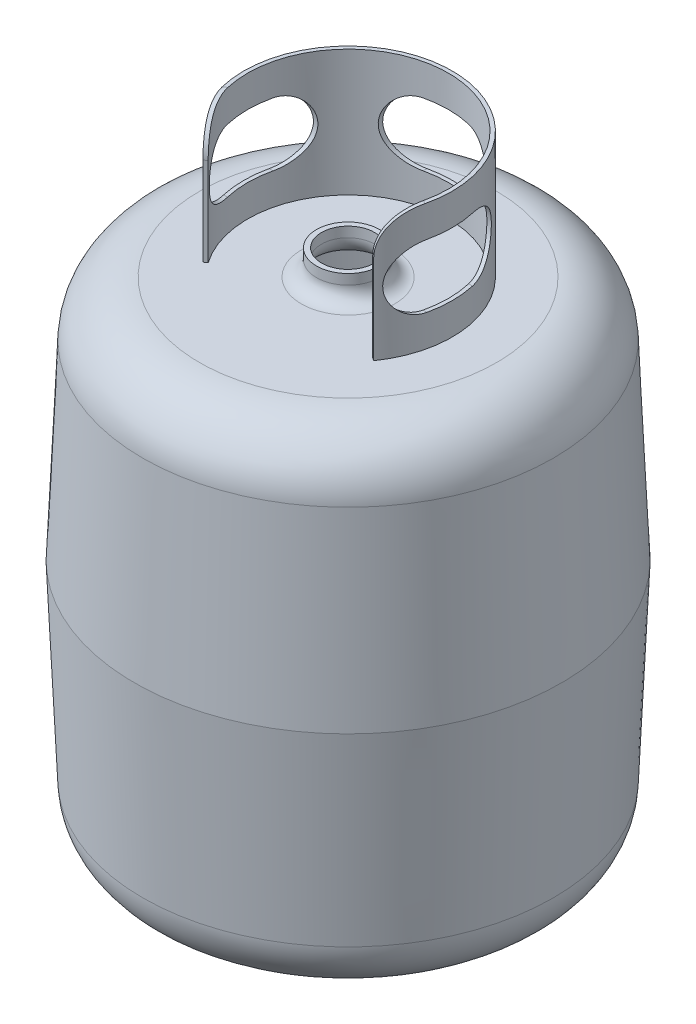
from build123d import *

# Parameters (mm, degrees)
SKETCH4_R           = 105.54283002881643
SKETCH4_R_2         = 102.54283002881643
BOSS_EXTRUDE1_DEPTH = 15
BOSS_EXTRUDE2_DEPTH = 100
FILLET1_R           = 30
CUT_EXTRUDE1_DEPTH  = 100
CUT_EXTRUDE2_DEPTH  = 200


with BuildPart() as part:
    # Sketch1 → Revolve1 (revolve)
    with BuildSketch(Plane.XY, mode=Mode.PRIVATE) as revolve1_sk:
        with BuildLine():
            Line((0, -193.75), (-117.54283002881643, -193.74999999999997))
            ThreePointArc((-117.54283002881643, -193.74999999999997), (-148.66091753901858, -181.25637829268894), (-162.5, -150.71287243143996))
            Line((-162.5, -150.71287243143996), (-169.08026611880643, 0))
            Line((-169.08026611880643, 0), (-162.5, 150.71287243143996))
            ThreePointArc((-162.5, 150.71287243143996), (-148.66091753901858, 181.25637829268894), (-117.54283002881643, 193.74999999999997))
            Line((-117.54283002881643, 193.74999999999997), (-37, 193.75))
            ThreePointArc((-37, 193.75), (-28.514718625761414, 197.26471862576145), (-25, 205.75000000000003))
            Line((-25, 205.75000000000003), (-25, 213.75))
            Line((-25, 213.75), (-21, 213.75))
            Line((-21, 213.75), (-21, 205.75000000000003))
            ThreePointArc((-21, 205.75000000000003), (-25.686291501015226, 194.43629150101526), (-37.00000000000001, 189.75))
            Line((-37.00000000000001, 189.75), (-117.54283002881644, 189.75))
            ThreePointArc((-117.54283002881644, 189.75), (-145.89486531588952, 178.3669224444499), (-158.50380711367256, 150.53839488197863))
            Line((-158.50380711367256, 150.53839488197863), (-165.07645537815316, -2.776e-14))
            Line((-165.07645537815316, -2.776e-14), (-158.50380711367256, -150.53839488197863))
            ThreePointArc((-158.50380711367256, -150.53839488197863), (-145.89486531588952, -178.3669224444499), (-117.54283002881644, -189.74999999999997))
            Line((-117.54283002881644, -189.74999999999997), (0, -189.75))
            Line((0, -189.75), (0, -193.75))
        make_face()
    revolve(revolve1_sk.sketch.rotate(Axis((0, 0, 0), (0, 1, 0)), 270), axis=Axis((0, 0, 0), (0, 1, 0)))

    # Sketch4 → Boss-Extrude1 (add, symmetric)
    with BuildSketch(Plane.XZ.offset(193.74999999999997)):
        with Locations(Location((0, 0, 0), (0, 0, 90))):
            Circle(SKETCH4_R)
        with Locations(Location((0, 0, 0), (0, 0, 90))):
            Circle(SKETCH4_R_2, mode=Mode.SUBTRACT)
    extrude(amount=BOSS_EXTRUDE1_DEPTH, both=True)

    # Sketch6 → Boss-Extrude2 (add)
    with BuildSketch(Plane(origin=(0, 193.74999999999997, 0), x_dir=(1, 0, 0), z_dir=(0, 1, 0))):
        with BuildLine():
            Line((-67.57797499591436, -47.318607509086355), (-65.12051886304744, -45.597878200033136))
            ThreePointArc((-65.12051886304744, -45.597878200033136), (5.6e-14, 79.49747463496922), (65.12051886304737, -45.597878200033236))
            Line((65.12051886304737, -45.597878200033236), (67.57797499591436, -47.31860750908634))
            ThreePointArc((67.57797499591436, -47.31860750908634), (-1.515e-14, 82.49747463496922), (-67.57797499591436, -47.318607509086355))
        make_face()
    extrude(amount=BOSS_EXTRUDE2_DEPTH)

    # Fillet1
    # the kernel refuses this fillet: 30 mm, written as the material it takes off along each edge
    with BuildSketch(Plane(origin=(-129.0143783175874, 293.75, 90.33684023541679), x_dir=(0, -1, 0), z_dir=(0.8191520442889735, 0, -0.5735764363510724))) as fillet1_piece_1:
        with BuildLine():
            CenterArc((FILLET1_R, FILLET1_R), FILLET1_R, 179.99999999999997, 90)
            Line((0, FILLET1_R), (0, 0))
            Line((0, 0), (FILLET1_R, 0))
        make_face()
    extrude(amount=153.00000000000006, mode=Mode.SUBTRACT)
    with BuildSketch(Plane(origin=(3.6841155413724422, 293.75, 2.5796454737055683), x_dir=(7e-17, -1, -1e-16), z_dir=(0.8191520442889991, 0, 0.5735764363510357))) as fillet1_piece_2:
        with BuildLine():
            CenterArc((FILLET1_R, FILLET1_R), FILLET1_R, 180, 90)
            Line((3.49e-15, FILLET1_R), (0, 0))
            Line((0, 0), (FILLET1_R, 0))
        make_face()
    extrude(amount=153, mode=Mode.SUBTRACT)

    # Sketch7 → Cut-Extrude1 (cut, symmetric)
    with BuildSketch(Plane(origin=(0, 0, 0), x_dir=(0, 0, -1), z_dir=(1, 0, 0))):
        with BuildLine():
            Line((-18, 268.75000000000006), (18, 268.75000000000006))
            ThreePointArc((18, 268.75000000000006), (43.000000000000085, 243.74999999999997), (18, 218.7499999999999))
            Line((18, 218.7499999999999), (-18, 218.7499999999999))
            ThreePointArc((-18, 218.7499999999999), (-43.000000000000085, 243.74999999999997), (-18, 268.75000000000006))
        make_face()
    extrude(amount=CUT_EXTRUDE1_DEPTH, both=True, mode=Mode.SUBTRACT)

    # Sketch8 → Cut-Extrude2 (cut)
    with BuildSketch(Plane.XY):
        with BuildLine():
            Line((-18, 268.74999999999994), (18, 268.74999999999994))
            ThreePointArc((18, 268.74999999999994), (43.00000000000003, 243.74999999999991), (18, 218.7499999999999))
            Line((18, 218.7499999999999), (-18, 218.7499999999999))
            ThreePointArc((-18, 218.7499999999999), (-43.00000000000003, 243.74999999999991), (-18, 268.74999999999994))
        make_face()
    extrude(amount=-CUT_EXTRUDE2_DEPTH, mode=Mode.SUBTRACT)


solid = part.part
